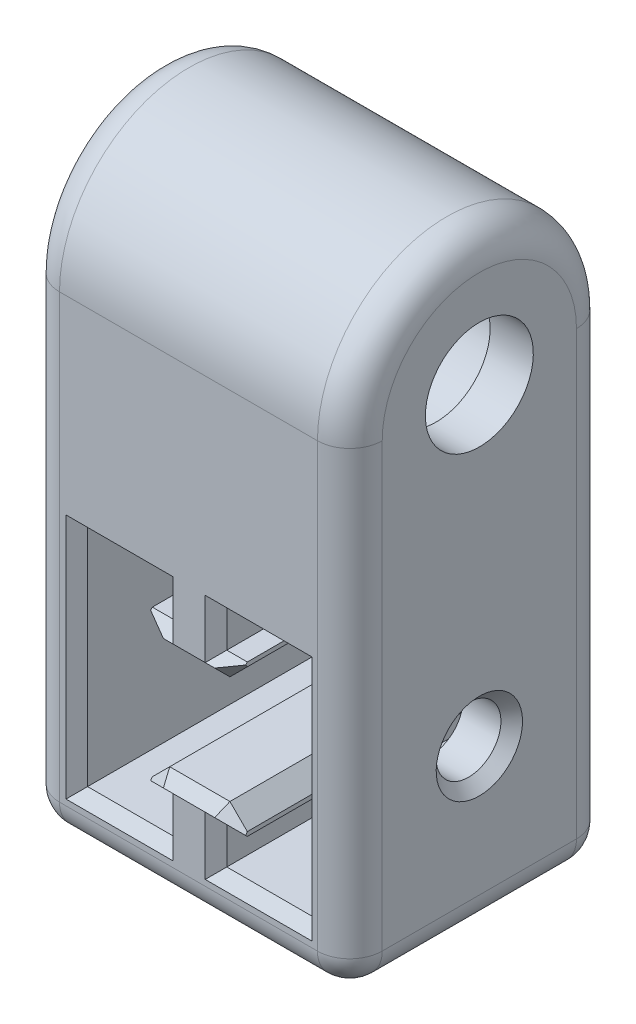
from build123d import *

# Parameters (mm, degrees)
BOSS_EXTRUDE1_DEPTH = 24
SKETCH5_R           = 6.9
BOSS_EXTRUDE3_DEPTH = 29.899298
SKETCH3_R           = 3
CUT_EXTRUDE1_DEPTH  = 57.133484
BOSS_EXTRUDE4_START = -4
SKETCH6_R           = 12
SKETCH6_R_2         = 5
BOSS_EXTRUDE4_DEPTH = 4
FILLET1_R           = 3
CHAMFER1_SIZE       = 1


with BuildPart() as part:
    # Sketch1 → Boss-Extrude1 (new body)
    with BuildSketch(Plane.XY):
        Polygon((0, 15), (14.899298, 15), (14.899298, -14.949649), (-15, -14.949649), (-15, 15), align=None)
        Polygon((-10.4, 10.4), (-2.5, 10.4), (-2.5, 7), (-4.4, 7), (-4.4, 6.61), (-2.79, 5), (2.79, 5), (4.4, 6.61), (4.4, 7), (2.5, 7), (2.5, 10.4), (10.4, 10.4), (10.4, 2.5), (10.4, -2.5), (10.4, -10.4), (2.5, -10.4), (2.5, -7), (4.4, -7), (4.4, -6.61), (2.79, -5), (-2.79, -5), (-4.4, -6.61), (-4.4, -7), (-2.5, -7), (-2.5, -10.4), (-10.4, -10.4), (-10.4, -2.5), (-10.4, 2.5), align=None, mode=Mode.SUBTRACT)
    extrude(amount=BOSS_EXTRUDE1_DEPTH)

    # Sketch5 → Boss-Extrude3 (add, through all)
    with BuildSketch(Plane.ZY.offset(15)):
        with BuildLine():
            Line((0, 15), (0, 22.5))
            Line((0, 22.5), (0, 29))
            ThreePointArc((0, 29), (12, 41), (24, 29))
            Line((24, 29), (24, 22.5))
            Line((24, 22.5), (24, 15))
            Line((24, 15), (0, 15))
        make_face()
        with Locations((12, 29)):
            Circle(SKETCH5_R, mode=Mode.SUBTRACT)
    extrude(amount=-BOSS_EXTRUDE3_DEPTH)

    # Sketch3 → Cut-Extrude1 (cut, through all)
    with BuildSketch(Plane.ZY.offset(15)):
        with Locations((12, 0)):
            Circle(SKETCH3_R)
    extrude(amount=-CUT_EXTRUDE1_DEPTH, mode=Mode.SUBTRACT)

    # Sketch6 → Boss-Extrude4 (add)
    with BuildSketch(Plane(origin=(14.899298, 0, 0), x_dir=(0, 0, -1), z_dir=(1, 0, 0)).offset(BOSS_EXTRUDE4_START)):
        with Locations((-12, 29)):
            Circle(SKETCH6_R)
        with Locations(Location((-12, 29, 0), (0, 0, 90))):
            Circle(SKETCH6_R_2, mode=Mode.SUBTRACT)
    extrude(amount=BOSS_EXTRUDE4_DEPTH)

    # Fillet1
    fillet1_edges = [part.edges().sort_by_distance(p)[0] for p in [
        (-0.050351, -14.949649, 24),
        (14.899298, 7.025175, 24),
        (14.899298, 0.025175, 0),
        (-0.050351, -14.949649, 0),
        (-15, 7.025175, 0),
        (-15, 7.025175, 24),
        (14.899298, -14.949649, 12),
        (-15, -14.949649, 12),
        (14.899298, 41, 12),
        (-15, 41, 12),
    ]]
    fillet(fillet1_edges, radius=FILLET1_R)

    # Chamfer1
    # the kernel refuses this chamfer: 1 mm, written as the material it takes off along each edge
    with BuildSketch(Plane(origin=(-15, 0, 12), x_dir=(0, 0, 1), z_dir=(0, -1, 0))) as chamfer1_piece_1:
        Polygon((3 + CHAMFER1_SIZE, 0), (3, -CHAMFER1_SIZE), (3, 0), align=None)
    revolve(axis=Axis((-15, 0, 12), (-1, 0, 0)), mode=Mode.SUBTRACT)
    with BuildSketch(Plane(origin=(-15, 29, 12), x_dir=(0, 0, 1), z_dir=(0, -1, 0))) as chamfer1_piece_2:
        Polygon((6.9, -CHAMFER1_SIZE), (6.9 + CHAMFER1_SIZE, 0), (6.9, 0), align=None)
    revolve(axis=Axis((-15, 29, 12), (-1, 0, 0)), mode=Mode.SUBTRACT)
    with BuildSketch(Plane(origin=(14.899298, 0, 12), x_dir=(0, 0, 1), z_dir=(0, -1, 0))) as chamfer1_piece_3:
        Polygon((3 + CHAMFER1_SIZE, 0), (3, CHAMFER1_SIZE), (3, 0), align=None)
    revolve(axis=Axis((14.899298, 0, 12), (-1, 0, 0)), mode=Mode.SUBTRACT)
    with BuildSketch(Plane(origin=(-2.5, 10.4, 24), x_dir=(0.9996219169112968, 1.9976458825347405e-14, 0.02749587661058563), z_dir=(0, -1, 0)), Plane(origin=(-2.5, -7, 24), x_dir=(0.9996219169112968, -3.394692349405443e-15, 0.02749587661058563), z_dir=(0, -1, 0)), Plane(origin=(2.5, -10.4, 24), x_dir=(-0.9996219169112968, -3.394692349405443e-15, 0.02749587661058563), z_dir=(0, 1, 0)), Plane(origin=(2.5, 7, 24), x_dir=(-0.9996219169112968, 4.700343253022921e-15, 0.02749587661058563), z_dir=(0, 1, 0))) as chamfer1_piece_4:
        Polygon((CHAMFER1_SIZE * 0.999621916911, -CHAMFER1_SIZE * 0.0274958766106), (-CHAMFER1_SIZE * 0.0274958766106, -CHAMFER1_SIZE * 0.999621916911), (0, 0), align=None)
    extrude(amount=3.4, mode=Mode.SUBTRACT)
    with BuildSketch(Plane(origin=(-10.4, 10.4, 24), x_dir=(0, 0.9996219169112968, 0.027495876610585647), z_dir=(1, 0, 0)), Plane(origin=(-2.5, -10.4, 24), x_dir=(0, -0.9996219169112968, 0.027495876610585647), z_dir=(-1, 0, 0)), Plane(origin=(10.4, -10.4, 24), x_dir=(2.247702821417434e-15, -0.9996219169112968, 0.027495876610585647), z_dir=(-1, 0, 0)), Plane(origin=(2.5, 10.4, 24), x_dir=(1.7981622571339484e-15, 0.9996219169112968, 0.027495876610585647), z_dir=(1, 0, 0)), Plane(origin=(-10.4, 10.4, 0), x_dir=(0, -0.02749587661058563, 0.9996219169112968), z_dir=(1, 0, 0))) as chamfer1_piece_5:
        Polygon((CHAMFER1_SIZE * 0.999621916911, -CHAMFER1_SIZE * 0.0274958766106), (-CHAMFER1_SIZE * 0.0274958766106, -CHAMFER1_SIZE * 0.999621916911), (0, 0), align=None)
    extrude(amount=7.9, mode=Mode.SUBTRACT)
    with BuildSketch(Plane(origin=(-10.4, 10.4, 24), x_dir=(-0.9996219169112968, 0, 0.027495876610585647), z_dir=(0, -1, 0)), Plane(origin=(10.4, -10.4, 24), x_dir=(0.9996219169112968, 0, 0.027495876610585647), z_dir=(0, 1, 0)), Plane(origin=(10.4, 10.4, 0), x_dir=(0.9996219169112968, 0, -0.027495876610586296), z_dir=(0, -1, 0)), Plane(origin=(-10.4, -10.4, 0), x_dir=(-0.9996219169112968, 0, -0.02749587661058661), z_dir=(0, 1, 0))) as chamfer1_piece_6:
        Polygon((CHAMFER1_SIZE * 0.999621916911, CHAMFER1_SIZE * 0.0274958766106), (-CHAMFER1_SIZE * 0.0274958766106, CHAMFER1_SIZE * 0.999621916911), (0, 0), align=None)
    extrude(amount=20.8, mode=Mode.SUBTRACT)
    with BuildSketch(Plane(origin=(-6.971683, -7, 24), x_dir=(0, 0.9996219169112968, 0.027495876610585623), z_dir=(1, 0, 0)), Plane(origin=(2.5, -7, 24), x_dir=(0, 0.9996219169112968, 0.027495876610585623), z_dir=(1, 0, 0)), Plane(origin=(6.971683, 7, 24), x_dir=(0, -0.9996219169112968, 0.027495876610585623), z_dir=(-1, 0, 0)), Plane(origin=(-2.5, 7, 24), x_dir=(0, -0.9996219169112968, 0.027495876610585623), z_dir=(-1, 0, 0))) as chamfer1_piece_7:
        Polygon((CHAMFER1_SIZE * 0.999621916911, -CHAMFER1_SIZE * 0.0274958766106), (-CHAMFER1_SIZE * 0.0274958766106, -CHAMFER1_SIZE * 0.999621916911), (0, 0), align=None)
    extrude(amount=4.471683, mode=Mode.SUBTRACT)
    with BuildSketch(Plane(origin=(-0.971546, -3.181546, 24), x_dir=(0.7068394360706722, -0.7068394360706748, 0.02749587661058563), z_dir=(-0.7071067811865488, -0.7071067811865462, 0)), Plane(origin=(6.218454, -8.428454, 24), x_dir=(-0.7068394360706722, -0.7068394360706749, 0.027495876610585664), z_dir=(-0.7071067811865488, 0.7071067811865462, 0)), Plane(origin=(0.971546, 3.181546, 24), x_dir=(-0.7068394360706717, 0.7068394360706753, 0.02749587661058563), z_dir=(0.7071067811865493, 0.7071067811865458, 0)), Plane(origin=(-6.218454, 8.428454, 24), x_dir=(0.7068394360706717, 0.7068394360706753, 0.02749587661058563), z_dir=(0.7071067811865493, -0.7071067811865458, 0))) as chamfer1_piece_8:
        Polygon((CHAMFER1_SIZE * 0.999621916911, -CHAMFER1_SIZE * 0.0274958766106), (-CHAMFER1_SIZE * 0.0274958766106, -CHAMFER1_SIZE * 0.999621916911), (0, 0), align=None)
    extrude(amount=7.42025, mode=Mode.SUBTRACT)
    with BuildSketch(Plane(origin=(5.361683, -5, 24), x_dir=(0, -0.9996219169112968, 0.027495876610585623), z_dir=(-1, 0, 0)), Plane(origin=(-5.361683, 5, 24), x_dir=(0, 0.9996219169112968, 0.027495876610585623), z_dir=(1, 0, 0))) as chamfer1_piece_9:
        Polygon((CHAMFER1_SIZE * 0.999621916911, -CHAMFER1_SIZE * 0.0274958766106), (-CHAMFER1_SIZE * 0.0274958766106, -CHAMFER1_SIZE * 0.999621916911), (0, 0), align=None)
    extrude(amount=10.723366, mode=Mode.SUBTRACT)
    with BuildSketch(Plane(origin=(-6.218454, 8.428454, 0), x_dir=(0.7068394360706717, 0.7068394360706753, -0.02749587661058635), z_dir=(0.7071067811865493, -0.7071067811865458, 0)), Plane(origin=(0.971546, 3.181546, 0), x_dir=(-0.7068394360706717, 0.7068394360706753, -0.027495876610586372), z_dir=(0.7071067811865493, 0.7071067811865458, 0)), Plane(origin=(6.218454, -8.428454, 0), x_dir=(-0.7068394360706722, -0.7068394360706749, -0.02749587661058643), z_dir=(-0.7071067811865488, 0.7071067811865462, 0)), Plane(origin=(-0.971546, -3.181546, 0), x_dir=(0.7068394360706722, -0.7068394360706749, -0.02749587661058638), z_dir=(-0.7071067811865488, -0.7071067811865462, 0))) as chamfer1_piece_10:
        Polygon((CHAMFER1_SIZE * 0.999621916911, CHAMFER1_SIZE * 0.0274958766106), (-CHAMFER1_SIZE * 0.0274958766106, CHAMFER1_SIZE * 0.999621916911), (0, 0), align=None)
    extrude(amount=7.42025, mode=Mode.SUBTRACT)
    with BuildSketch(Plane(origin=(-5.361683, 5, 0), x_dir=(0, 0.9996219169112968, -0.027495876610586365), z_dir=(1, 0, 0)), Plane(origin=(5.361683, -5, 0), x_dir=(0, -0.9996219169112968, -0.027495876610586365), z_dir=(-1, 0, 0))) as chamfer1_piece_11:
        Polygon((CHAMFER1_SIZE * 0.999621916911, CHAMFER1_SIZE * 0.0274958766106), (-CHAMFER1_SIZE * 0.0274958766106, CHAMFER1_SIZE * 0.999621916911), (0, 0), align=None)
    extrude(amount=10.723366, mode=Mode.SUBTRACT)
    with BuildSketch(Plane(origin=(6.971683, 7, 0), x_dir=(0, -0.9996219169112968, -0.027495876610586365), z_dir=(-1, 0, 0)), Plane(origin=(2.5, -7, 0), x_dir=(0, 0.9996219169112968, -0.027495876610586365), z_dir=(1, 0, 0)), Plane(origin=(-6.971683, -7, 0), x_dir=(0, 0.9996219169112968, -0.027495876610586365), z_dir=(1, 0, 0)), Plane(origin=(-2.5, 7, 0), x_dir=(0, -0.9996219169112968, -0.027495876610586365), z_dir=(-1, 0, 0))) as chamfer1_piece_12:
        Polygon((CHAMFER1_SIZE * 0.999621916911, CHAMFER1_SIZE * 0.0274958766106), (-CHAMFER1_SIZE * 0.0274958766106, CHAMFER1_SIZE * 0.999621916911), (0, 0), align=None)
    extrude(amount=4.471683, mode=Mode.SUBTRACT)
    with BuildSketch(Plane(origin=(2.5, 7, 0), x_dir=(-0.9996219169112968, 4.700343253022921e-15, -0.027495876610586372), z_dir=(0, 1, 0)), Plane(origin=(2.5, -10.4, 0), x_dir=(-0.9996219169112968, -3.394692349405443e-15, -0.027495876610586372), z_dir=(0, 1, 0)), Plane(origin=(-2.5, -7, 0), x_dir=(0.9996219169112968, -3.394692349405443e-15, -0.027495876610586372), z_dir=(0, -1, 0)), Plane(origin=(-2.5, 10.4, 0), x_dir=(0.9996219169112968, 1.9976458825347405e-14, -0.027495876610586372), z_dir=(0, -1, 0))) as chamfer1_piece_13:
        Polygon((CHAMFER1_SIZE * 0.999621916911, CHAMFER1_SIZE * 0.0274958766106), (-CHAMFER1_SIZE * 0.0274958766106, CHAMFER1_SIZE * 0.999621916911), (0, 0), align=None)
    extrude(amount=3.4, mode=Mode.SUBTRACT)
    with BuildSketch(Plane(origin=(2.5, 10.4, 0), x_dir=(1.7981622571339484e-15, 0.9996219169112968, -0.02749587661058639), z_dir=(1, 0, 0)), Plane(origin=(10.4, -10.4, 0), x_dir=(2.247702821417434e-15, -0.9996219169112968, -0.02749587661058639), z_dir=(-1, 0, 0)), Plane(origin=(-2.5, -10.4, 0), x_dir=(0, -0.9996219169112968, -0.02749587661058639), z_dir=(-1, 0, 0))) as chamfer1_piece_14:
        Polygon((CHAMFER1_SIZE * 0.999621916911, CHAMFER1_SIZE * 0.0274958766106), (-CHAMFER1_SIZE * 0.0274958766106, CHAMFER1_SIZE * 0.999621916911), (0, 0), align=None)
    extrude(amount=7.9, mode=Mode.SUBTRACT)
    with BuildSketch(Plane(origin=(-2.5, 12.971683, 24), x_dir=(0.9996219169112968, 1.9976458825347405e-14, 0.02749587661058563), z_dir=(0, -1, 0))) as chamfer1_piece_15a_section:
        Polygon((CHAMFER1_SIZE * 0.999621916911, -CHAMFER1_SIZE * 0.0274958766106), (-CHAMFER1_SIZE * 0.0274958766106, -CHAMFER1_SIZE * 0.999621916911), (0, 0), align=None)
    chamfer1_piece_15a = extrude(amount=5.971683, mode=Mode.PRIVATE)
    chamfer1_piece_15a = split(chamfer1_piece_15a, bisect_by=Plane(origin=(-2.170206, 10.4, 23.670206), z_dir=(0, 1, 0)), keep=Keep.TOP, mode=Mode.PRIVATE)
    with BuildSketch(Plane(origin=(-10.4, 10.4, 24), x_dir=(0, 0.9996219169112968, 0.027495876610585647), z_dir=(1, 0, 0))) as chamfer1_piece_15b_section:
        Polygon((CHAMFER1_SIZE * 0.999621916911, -CHAMFER1_SIZE * 0.0274958766106), (-CHAMFER1_SIZE * 0.0274958766106, -CHAMFER1_SIZE * 0.999621916911), (0, 0), align=None)
    chamfer1_piece_15b = extrude(amount=10.471683, mode=Mode.PRIVATE)
    chamfer1_piece_15b = split(chamfer1_piece_15b, bisect_by=Plane(origin=(-2.5, 10.729794, 23.670206), z_dir=(1, 0, 0)), keep=Keep.TOP, mode=Mode.PRIVATE)
    chamfer1_piece_15 = chamfer1_piece_15a & chamfer1_piece_15b
    add(chamfer1_piece_15, mode=Mode.SUBTRACT)
    with BuildSketch(Plane(origin=(0.071683, 7, 24), x_dir=(0, -0.9996219169112968, 0.027495876610585623), z_dir=(-1, 0, 0))) as chamfer1_piece_16a_section:
        Polygon((CHAMFER1_SIZE * 0.999621916911, -CHAMFER1_SIZE * 0.0274958766106), (-CHAMFER1_SIZE * 0.0274958766106, -CHAMFER1_SIZE * 0.999621916911), (0, 0), align=None)
    chamfer1_piece_16a = extrude(amount=7.043366, mode=Mode.PRIVATE)
    chamfer1_piece_16a = split(chamfer1_piece_16a, bisect_by=Plane(origin=(-2.5, 6.670206, 23.670206), z_dir=(1, 0, 0)), keep=Keep.TOP, mode=Mode.PRIVATE)
    with BuildSketch(Plane(origin=(-2.5, 10.4, 24), x_dir=(0.9996219169112968, 1.9976458825347405e-14, 0.02749587661058563), z_dir=(0, -1, 0))) as chamfer1_piece_16b_section:
        Polygon((CHAMFER1_SIZE * 0.999621916911, -CHAMFER1_SIZE * 0.0274958766106), (-CHAMFER1_SIZE * 0.0274958766106, -CHAMFER1_SIZE * 0.999621916911), (0, 0), align=None)
    chamfer1_piece_16b = extrude(amount=5.971683, mode=Mode.PRIVATE)
    chamfer1_piece_16b = split(chamfer1_piece_16b, bisect_by=Plane(origin=(-2.170206, 7, 23.670206), z_dir=(0, -1, 0)), keep=Keep.TOP, mode=Mode.PRIVATE)
    chamfer1_piece_16 = chamfer1_piece_16a & chamfer1_piece_16b
    add(chamfer1_piece_16, mode=Mode.SUBTRACT)
    with BuildSketch(Plane(origin=(-10.4, 12.971683, 24), x_dir=(-0.9996219169112968, 0, 0.027495876610585647), z_dir=(0, -1, 0))) as chamfer1_piece_17a_section:
        Polygon((CHAMFER1_SIZE * 0.999621916911, CHAMFER1_SIZE * 0.0274958766106), (-CHAMFER1_SIZE * 0.0274958766106, CHAMFER1_SIZE * 0.999621916911), (0, 0), align=None)
    chamfer1_piece_17a = extrude(amount=23.371683, mode=Mode.PRIVATE)
    chamfer1_piece_17a = split(chamfer1_piece_17a, bisect_by=Plane(origin=(-10.729794, 10.4, 23.670206), z_dir=(0, 1, 0)), keep=Keep.TOP, mode=Mode.PRIVATE)
    with BuildSketch(Plane(origin=(-12.971683, 10.4, 24), x_dir=(0, 0.9996219169112968, 0.027495876610585647), z_dir=(1, 0, 0))) as chamfer1_piece_17b_section:
        Polygon((CHAMFER1_SIZE * 0.999621916911, -CHAMFER1_SIZE * 0.0274958766106), (-CHAMFER1_SIZE * 0.0274958766106, -CHAMFER1_SIZE * 0.999621916911), (0, 0), align=None)
    chamfer1_piece_17b = extrude(amount=10.471683, mode=Mode.PRIVATE)
    chamfer1_piece_17b = split(chamfer1_piece_17b, bisect_by=Plane(origin=(-10.4, 10.729794, 23.670206), z_dir=(-1, 0, 0)), keep=Keep.TOP, mode=Mode.PRIVATE)
    chamfer1_piece_17 = chamfer1_piece_17a & chamfer1_piece_17b
    add(chamfer1_piece_17, mode=Mode.SUBTRACT)
    with BuildSketch(Plane(origin=(-10.4, 10.4, 24), x_dir=(-0.9996219169112968, 0, 0.027495876610585647), z_dir=(0, -1, 0))) as chamfer1_piece_18a_section:
        Polygon((CHAMFER1_SIZE * 0.999621916911, CHAMFER1_SIZE * 0.0274958766106), (-CHAMFER1_SIZE * 0.0274958766106, CHAMFER1_SIZE * 0.999621916911), (0, 0), align=None)
    chamfer1_piece_18a = extrude(amount=23.371683, mode=Mode.PRIVATE)
    chamfer1_piece_18a = split(chamfer1_piece_18a, bisect_by=Plane(origin=(-10.729794, -10.4, 23.670206), z_dir=(0, -1, 0)), keep=Keep.TOP, mode=Mode.PRIVATE)
    with BuildSketch(Plane(origin=(-2.5, -10.4, 24), x_dir=(0, -0.9996219169112968, 0.027495876610585647), z_dir=(-1, 0, 0))) as chamfer1_piece_18b_section:
        Polygon((CHAMFER1_SIZE * 0.999621916911, -CHAMFER1_SIZE * 0.0274958766106), (-CHAMFER1_SIZE * 0.0274958766106, -CHAMFER1_SIZE * 0.999621916911), (0, 0), align=None)
    chamfer1_piece_18b = extrude(amount=10.471683, mode=Mode.PRIVATE)
    chamfer1_piece_18b = split(chamfer1_piece_18b, bisect_by=Plane(origin=(-10.4, -10.729794, 23.670206), z_dir=(-1, 0, 0)), keep=Keep.TOP, mode=Mode.PRIVATE)
    chamfer1_piece_18 = chamfer1_piece_18a & chamfer1_piece_18b
    add(chamfer1_piece_18, mode=Mode.SUBTRACT)
    with BuildSketch(Plane(origin=(0.071683, -10.4, 24), x_dir=(0, -0.9996219169112968, 0.027495876610585647), z_dir=(-1, 0, 0))) as chamfer1_piece_19a_section:
        Polygon((CHAMFER1_SIZE * 0.999621916911, -CHAMFER1_SIZE * 0.0274958766106), (-CHAMFER1_SIZE * 0.0274958766106, -CHAMFER1_SIZE * 0.999621916911), (0, 0), align=None)
    chamfer1_piece_19a = extrude(amount=10.471683, mode=Mode.PRIVATE)
    chamfer1_piece_19a = split(chamfer1_piece_19a, bisect_by=Plane(origin=(-2.5, -10.729794, 23.670206), z_dir=(1, 0, 0)), keep=Keep.TOP, mode=Mode.PRIVATE)
    with BuildSketch(Plane(origin=(-2.5, -7, 24), x_dir=(0.9996219169112968, -3.394692349405443e-15, 0.02749587661058563), z_dir=(0, -1, 0))) as chamfer1_piece_19b_section:
        Polygon((CHAMFER1_SIZE * 0.999621916911, -CHAMFER1_SIZE * 0.0274958766106), (-CHAMFER1_SIZE * 0.0274958766106, -CHAMFER1_SIZE * 0.999621916911), (0, 0), align=None)
    chamfer1_piece_19b = extrude(amount=5.971683, mode=Mode.PRIVATE)
    chamfer1_piece_19b = split(chamfer1_piece_19b, bisect_by=Plane(origin=(-2.170206, -10.4, 23.670206), z_dir=(0, -1, 0)), keep=Keep.TOP, mode=Mode.PRIVATE)
    chamfer1_piece_19 = chamfer1_piece_19a & chamfer1_piece_19b
    add(chamfer1_piece_19, mode=Mode.SUBTRACT)
    with BuildSketch(Plane(origin=(-2.5, -4.428317, 24), x_dir=(0.9996219169112968, -3.394692349405443e-15, 0.02749587661058563), z_dir=(0, -1, 0))) as chamfer1_piece_20a_section:
        Polygon((CHAMFER1_SIZE * 0.999621916911, -CHAMFER1_SIZE * 0.0274958766106), (-CHAMFER1_SIZE * 0.0274958766106, -CHAMFER1_SIZE * 0.999621916911), (0, 0), align=None)
    chamfer1_piece_20a = extrude(amount=5.971683, mode=Mode.PRIVATE)
    chamfer1_piece_20a = split(chamfer1_piece_20a, bisect_by=Plane(origin=(-2.170206, -7, 23.670206), z_dir=(0, 1, 0)), keep=Keep.TOP, mode=Mode.PRIVATE)
    with BuildSketch(Plane(origin=(-6.971683, -7, 24), x_dir=(0, 0.9996219169112968, 0.027495876610585623), z_dir=(1, 0, 0))) as chamfer1_piece_20b_section:
        Polygon((CHAMFER1_SIZE * 0.999621916911, -CHAMFER1_SIZE * 0.0274958766106), (-CHAMFER1_SIZE * 0.0274958766106, -CHAMFER1_SIZE * 0.999621916911), (0, 0), align=None)
    chamfer1_piece_20b = extrude(amount=7.043366, mode=Mode.PRIVATE)
    chamfer1_piece_20b = split(chamfer1_piece_20b, bisect_by=Plane(origin=(-2.5, -6.670206, 23.670206), z_dir=(1, 0, 0)), keep=Keep.TOP, mode=Mode.PRIVATE)
    chamfer1_piece_20 = chamfer1_piece_20a & chamfer1_piece_20b
    add(chamfer1_piece_20, mode=Mode.SUBTRACT)
    with BuildSketch(Plane(origin=(-0.071683, -7, 24), x_dir=(0, 0.9996219169112968, 0.027495876610585623), z_dir=(1, 0, 0))) as chamfer1_piece_21a_section:
        Polygon((CHAMFER1_SIZE * 0.999621916911, -CHAMFER1_SIZE * 0.0274958766106), (-CHAMFER1_SIZE * 0.0274958766106, -CHAMFER1_SIZE * 0.999621916911), (0, 0), align=None)
    chamfer1_piece_21a = extrude(amount=7.043366, mode=Mode.PRIVATE)
    chamfer1_piece_21a = split(chamfer1_piece_21a, bisect_by=Plane(origin=(2.5, -6.670206, 23.670206), z_dir=(-1, 0, 0)), keep=Keep.TOP, mode=Mode.PRIVATE)
    with BuildSketch(Plane(origin=(2.5, -10.4, 24), x_dir=(-0.9996219169112968, -3.394692349405443e-15, 0.02749587661058563), z_dir=(0, 1, 0))) as chamfer1_piece_21b_section:
        Polygon((CHAMFER1_SIZE * 0.999621916911, -CHAMFER1_SIZE * 0.0274958766106), (-CHAMFER1_SIZE * 0.0274958766106, -CHAMFER1_SIZE * 0.999621916911), (0, 0), align=None)
    chamfer1_piece_21b = extrude(amount=5.971683, mode=Mode.PRIVATE)
    chamfer1_piece_21b = split(chamfer1_piece_21b, bisect_by=Plane(origin=(2.170206, -7, 23.670206), z_dir=(0, 1, 0)), keep=Keep.TOP, mode=Mode.PRIVATE)
    chamfer1_piece_21 = chamfer1_piece_21a & chamfer1_piece_21b
    add(chamfer1_piece_21, mode=Mode.SUBTRACT)
    with BuildSketch(Plane(origin=(2.5, -12.971683, 24), x_dir=(-0.9996219169112968, -3.394692349405443e-15, 0.02749587661058563), z_dir=(0, 1, 0))) as chamfer1_piece_22a_section:
        Polygon((CHAMFER1_SIZE * 0.999621916911, -CHAMFER1_SIZE * 0.0274958766106), (-CHAMFER1_SIZE * 0.0274958766106, -CHAMFER1_SIZE * 0.999621916911), (0, 0), align=None)
    chamfer1_piece_22a = extrude(amount=5.971683, mode=Mode.PRIVATE)
    chamfer1_piece_22a = split(chamfer1_piece_22a, bisect_by=Plane(origin=(2.170206, -10.4, 23.670206), z_dir=(0, -1, 0)), keep=Keep.TOP, mode=Mode.PRIVATE)
    with BuildSketch(Plane(origin=(10.4, -10.4, 24), x_dir=(2.247702821417434e-15, -0.9996219169112968, 0.027495876610585647), z_dir=(-1, 0, 0))) as chamfer1_piece_22b_section:
        Polygon((CHAMFER1_SIZE * 0.999621916911, -CHAMFER1_SIZE * 0.0274958766106), (-CHAMFER1_SIZE * 0.0274958766106, -CHAMFER1_SIZE * 0.999621916911), (0, 0), align=None)
    chamfer1_piece_22b = extrude(amount=10.471683, mode=Mode.PRIVATE)
    chamfer1_piece_22b = split(chamfer1_piece_22b, bisect_by=Plane(origin=(2.5, -10.729794, 23.670206), z_dir=(-1, 0, 0)), keep=Keep.TOP, mode=Mode.PRIVATE)
    chamfer1_piece_22 = chamfer1_piece_22a & chamfer1_piece_22b
    add(chamfer1_piece_22, mode=Mode.SUBTRACT)
    with BuildSketch(Plane(origin=(12.971683, -10.4, 24), x_dir=(2.247702821417434e-15, -0.9996219169112968, 0.027495876610585647), z_dir=(-1, 0, 0))) as chamfer1_piece_23a_section:
        Polygon((CHAMFER1_SIZE * 0.999621916911, -CHAMFER1_SIZE * 0.0274958766106), (-CHAMFER1_SIZE * 0.0274958766106, -CHAMFER1_SIZE * 0.999621916911), (0, 0), align=None)
    chamfer1_piece_23a = extrude(amount=10.471683, mode=Mode.PRIVATE)
    chamfer1_piece_23a = split(chamfer1_piece_23a, bisect_by=Plane(origin=(10.4, -10.729794, 23.670206), z_dir=(1, 0, 0)), keep=Keep.TOP, mode=Mode.PRIVATE)
    with BuildSketch(Plane(origin=(10.4, -12.971683, 24), x_dir=(0.9996219169112968, 0, 0.027495876610585647), z_dir=(0, 1, 0))) as chamfer1_piece_23b_section:
        Polygon((CHAMFER1_SIZE * 0.999621916911, CHAMFER1_SIZE * 0.0274958766106), (-CHAMFER1_SIZE * 0.0274958766106, CHAMFER1_SIZE * 0.999621916911), (0, 0), align=None)
    chamfer1_piece_23b = extrude(amount=23.371683, mode=Mode.PRIVATE)
    chamfer1_piece_23b = split(chamfer1_piece_23b, bisect_by=Plane(origin=(10.729794, -10.4, 23.670206), z_dir=(0, -1, 0)), keep=Keep.TOP, mode=Mode.PRIVATE)
    chamfer1_piece_23 = chamfer1_piece_23a & chamfer1_piece_23b
    add(chamfer1_piece_23, mode=Mode.SUBTRACT)
    with BuildSketch(Plane(origin=(10.4, -10.4, 24), x_dir=(0.9996219169112968, 0, 0.027495876610585647), z_dir=(0, 1, 0))) as chamfer1_piece_24a_section:
        Polygon((CHAMFER1_SIZE * 0.999621916911, CHAMFER1_SIZE * 0.0274958766106), (-CHAMFER1_SIZE * 0.0274958766106, CHAMFER1_SIZE * 0.999621916911), (0, 0), align=None)
    chamfer1_piece_24a = extrude(amount=23.371683, mode=Mode.PRIVATE)
    chamfer1_piece_24a = split(chamfer1_piece_24a, bisect_by=Plane(origin=(10.729794, 10.4, 23.670206), z_dir=(0, 1, 0)), keep=Keep.TOP, mode=Mode.PRIVATE)
    with BuildSketch(Plane(origin=(2.5, 10.4, 24), x_dir=(1.7981622571339484e-15, 0.9996219169112968, 0.027495876610585647), z_dir=(1, 0, 0))) as chamfer1_piece_24b_section:
        Polygon((CHAMFER1_SIZE * 0.999621916911, -CHAMFER1_SIZE * 0.0274958766106), (-CHAMFER1_SIZE * 0.0274958766106, -CHAMFER1_SIZE * 0.999621916911), (0, 0), align=None)
    chamfer1_piece_24b = extrude(amount=10.471683, mode=Mode.PRIVATE)
    chamfer1_piece_24b = split(chamfer1_piece_24b, bisect_by=Plane(origin=(10.4, 10.729794, 23.670206), z_dir=(1, 0, 0)), keep=Keep.TOP, mode=Mode.PRIVATE)
    chamfer1_piece_24 = chamfer1_piece_24a & chamfer1_piece_24b
    add(chamfer1_piece_24, mode=Mode.SUBTRACT)
    with BuildSketch(Plane(origin=(-0.071683, 10.4, 24), x_dir=(1.7981622571339484e-15, 0.9996219169112968, 0.027495876610585647), z_dir=(1, 0, 0))) as chamfer1_piece_25a_section:
        Polygon((CHAMFER1_SIZE * 0.999621916911, -CHAMFER1_SIZE * 0.0274958766106), (-CHAMFER1_SIZE * 0.0274958766106, -CHAMFER1_SIZE * 0.999621916911), (0, 0), align=None)
    chamfer1_piece_25a = extrude(amount=10.471683, mode=Mode.PRIVATE)
    chamfer1_piece_25a = split(chamfer1_piece_25a, bisect_by=Plane(origin=(2.5, 10.729794, 23.670206), z_dir=(-1, 0, 0)), keep=Keep.TOP, mode=Mode.PRIVATE)
    with BuildSketch(Plane(origin=(2.5, 7, 24), x_dir=(-0.9996219169112968, 4.700343253022921e-15, 0.02749587661058563), z_dir=(0, 1, 0))) as chamfer1_piece_25b_section:
        Polygon((CHAMFER1_SIZE * 0.999621916911, -CHAMFER1_SIZE * 0.0274958766106), (-CHAMFER1_SIZE * 0.0274958766106, -CHAMFER1_SIZE * 0.999621916911), (0, 0), align=None)
    chamfer1_piece_25b = extrude(amount=5.971683, mode=Mode.PRIVATE)
    chamfer1_piece_25b = split(chamfer1_piece_25b, bisect_by=Plane(origin=(2.170206, 10.4, 23.670206), z_dir=(0, 1, 0)), keep=Keep.TOP, mode=Mode.PRIVATE)
    chamfer1_piece_25 = chamfer1_piece_25a & chamfer1_piece_25b
    add(chamfer1_piece_25, mode=Mode.SUBTRACT)
    with BuildSketch(Plane(origin=(2.5, 4.428317, 24), x_dir=(-0.9996219169112968, 4.700343253022921e-15, 0.02749587661058563), z_dir=(0, 1, 0))) as chamfer1_piece_26a_section:
        Polygon((CHAMFER1_SIZE * 0.999621916911, -CHAMFER1_SIZE * 0.0274958766106), (-CHAMFER1_SIZE * 0.0274958766106, -CHAMFER1_SIZE * 0.999621916911), (0, 0), align=None)
    chamfer1_piece_26a = extrude(amount=5.971683, mode=Mode.PRIVATE)
    chamfer1_piece_26a = split(chamfer1_piece_26a, bisect_by=Plane(origin=(2.170206, 7, 23.670206), z_dir=(0, -1, 0)), keep=Keep.TOP, mode=Mode.PRIVATE)
    with BuildSketch(Plane(origin=(6.971683, 7, 24), x_dir=(0, -0.9996219169112968, 0.027495876610585623), z_dir=(-1, 0, 0))) as chamfer1_piece_26b_section:
        Polygon((CHAMFER1_SIZE * 0.999621916911, -CHAMFER1_SIZE * 0.0274958766106), (-CHAMFER1_SIZE * 0.0274958766106, -CHAMFER1_SIZE * 0.999621916911), (0, 0), align=None)
    chamfer1_piece_26b = extrude(amount=7.043366, mode=Mode.PRIVATE)
    chamfer1_piece_26b = split(chamfer1_piece_26b, bisect_by=Plane(origin=(2.5, 6.670206, 23.670206), z_dir=(-1, 0, 0)), keep=Keep.TOP, mode=Mode.PRIVATE)
    chamfer1_piece_26 = chamfer1_piece_26a & chamfer1_piece_26b
    add(chamfer1_piece_26, mode=Mode.SUBTRACT)
    with BuildSketch(Plane(origin=(2.5, 4.428317, 0), x_dir=(-0.9996219169112968, 4.700343253022921e-15, -0.027495876610586372), z_dir=(0, 1, 0))) as chamfer1_piece_27a_section:
        Polygon((CHAMFER1_SIZE * 0.999621916911, CHAMFER1_SIZE * 0.0274958766106), (-CHAMFER1_SIZE * 0.0274958766106, CHAMFER1_SIZE * 0.999621916911), (0, 0), align=None)
    chamfer1_piece_27a = extrude(amount=5.971683, mode=Mode.PRIVATE)
    chamfer1_piece_27a = split(chamfer1_piece_27a, bisect_by=Plane(origin=(2.170206, 7, 0.329794), z_dir=(0, -1, 0)), keep=Keep.TOP, mode=Mode.PRIVATE)
    with BuildSketch(Plane(origin=(6.971683, 7, 0), x_dir=(0, -0.9996219169112968, -0.027495876610586365), z_dir=(-1, 0, 0))) as chamfer1_piece_27b_section:
        Polygon((CHAMFER1_SIZE * 0.999621916911, CHAMFER1_SIZE * 0.0274958766106), (-CHAMFER1_SIZE * 0.0274958766106, CHAMFER1_SIZE * 0.999621916911), (0, 0), align=None)
    chamfer1_piece_27b = extrude(amount=7.043366, mode=Mode.PRIVATE)
    chamfer1_piece_27b = split(chamfer1_piece_27b, bisect_by=Plane(origin=(2.5, 6.670206, 0.329794), z_dir=(-1, 0, 0)), keep=Keep.TOP, mode=Mode.PRIVATE)
    chamfer1_piece_27 = chamfer1_piece_27a & chamfer1_piece_27b
    add(chamfer1_piece_27, mode=Mode.SUBTRACT)
    with BuildSketch(Plane(origin=(-0.071683, 10.4, 0), x_dir=(1.7981622571339484e-15, 0.9996219169112968, -0.02749587661058639), z_dir=(1, 0, 0))) as chamfer1_piece_28a_section:
        Polygon((CHAMFER1_SIZE * 0.999621916911, CHAMFER1_SIZE * 0.0274958766106), (-CHAMFER1_SIZE * 0.0274958766106, CHAMFER1_SIZE * 0.999621916911), (0, 0), align=None)
    chamfer1_piece_28a = extrude(amount=10.471683, mode=Mode.PRIVATE)
    chamfer1_piece_28a = split(chamfer1_piece_28a, bisect_by=Plane(origin=(2.5, 10.729794, 0.329794), z_dir=(-1, 0, 0)), keep=Keep.TOP, mode=Mode.PRIVATE)
    with BuildSketch(Plane(origin=(2.5, 7, 0), x_dir=(-0.9996219169112968, 4.700343253022921e-15, -0.027495876610586372), z_dir=(0, 1, 0))) as chamfer1_piece_28b_section:
        Polygon((CHAMFER1_SIZE * 0.999621916911, CHAMFER1_SIZE * 0.0274958766106), (-CHAMFER1_SIZE * 0.0274958766106, CHAMFER1_SIZE * 0.999621916911), (0, 0), align=None)
    chamfer1_piece_28b = extrude(amount=5.971683, mode=Mode.PRIVATE)
    chamfer1_piece_28b = split(chamfer1_piece_28b, bisect_by=Plane(origin=(2.170206, 10.4, 0.329794), z_dir=(0, 1, 0)), keep=Keep.TOP, mode=Mode.PRIVATE)
    chamfer1_piece_28 = chamfer1_piece_28a & chamfer1_piece_28b
    add(chamfer1_piece_28, mode=Mode.SUBTRACT)
    with BuildSketch(Plane(origin=(10.4, 12.971683, 0), x_dir=(0.9996219169112968, 0, -0.02749587661058639), z_dir=(0, -1, 0))) as chamfer1_piece_29a_section:
        Polygon((CHAMFER1_SIZE * 0.999621916911, CHAMFER1_SIZE * 0.0274958766106), (-CHAMFER1_SIZE * 0.0274958766106, CHAMFER1_SIZE * 0.999621916911), (0, 0), align=None)
    chamfer1_piece_29a = extrude(amount=23.371683, mode=Mode.PRIVATE)
    chamfer1_piece_29a = split(chamfer1_piece_29a, bisect_by=Plane(origin=(10.729794, 10.4, 0.329794), z_dir=(0, 1, 0)), keep=Keep.TOP, mode=Mode.PRIVATE)
    with BuildSketch(Plane(origin=(2.5, 10.4, 0), x_dir=(1.7981622571339484e-15, 0.9996219169112968, -0.02749587661058639), z_dir=(1, 0, 0))) as chamfer1_piece_29b_section:
        Polygon((CHAMFER1_SIZE * 0.999621916911, CHAMFER1_SIZE * 0.0274958766106), (-CHAMFER1_SIZE * 0.0274958766106, CHAMFER1_SIZE * 0.999621916911), (0, 0), align=None)
    chamfer1_piece_29b = extrude(amount=10.471683, mode=Mode.PRIVATE)
    chamfer1_piece_29b = split(chamfer1_piece_29b, bisect_by=Plane(origin=(10.4, 10.729794, 0.329794), z_dir=(1, 0, 0)), keep=Keep.TOP, mode=Mode.PRIVATE)
    chamfer1_piece_29 = chamfer1_piece_29a & chamfer1_piece_29b
    add(chamfer1_piece_29, mode=Mode.SUBTRACT)
    with BuildSketch(Plane(origin=(12.971683, -10.4, 0), x_dir=(2.247702821417434e-15, -0.9996219169112968, -0.02749587661058639), z_dir=(-1, 0, 0))) as chamfer1_piece_30a_section:
        Polygon((CHAMFER1_SIZE * 0.999621916911, CHAMFER1_SIZE * 0.0274958766106), (-CHAMFER1_SIZE * 0.0274958766106, CHAMFER1_SIZE * 0.999621916911), (0, 0), align=None)
    chamfer1_piece_30a = extrude(amount=10.471683, mode=Mode.PRIVATE)
    chamfer1_piece_30a = split(chamfer1_piece_30a, bisect_by=Plane(origin=(10.4, -10.729794, 0.329794), z_dir=(1, 0, 0)), keep=Keep.TOP, mode=Mode.PRIVATE)
    with BuildSketch(Plane(origin=(10.4, 10.4, 0), x_dir=(0.9996219169112968, 0, -0.027495876610586296), z_dir=(0, -1, 0))) as chamfer1_piece_30b_section:
        Polygon((CHAMFER1_SIZE * 0.999621916911, CHAMFER1_SIZE * 0.0274958766106), (-CHAMFER1_SIZE * 0.0274958766106, CHAMFER1_SIZE * 0.999621916911), (0, 0), align=None)
    chamfer1_piece_30b = extrude(amount=23.371683, mode=Mode.PRIVATE)
    chamfer1_piece_30b = split(chamfer1_piece_30b, bisect_by=Plane(origin=(10.729794, -10.4, 0.329794), z_dir=(0, -1, 0)), keep=Keep.TOP, mode=Mode.PRIVATE)
    chamfer1_piece_30 = chamfer1_piece_30a & chamfer1_piece_30b
    add(chamfer1_piece_30, mode=Mode.SUBTRACT)
    with BuildSketch(Plane(origin=(2.5, -12.971683, 0), x_dir=(-0.9996219169112968, -3.394692349405443e-15, -0.027495876610586372), z_dir=(0, 1, 0))) as chamfer1_piece_31a_section:
        Polygon((CHAMFER1_SIZE * 0.999621916911, CHAMFER1_SIZE * 0.0274958766106), (-CHAMFER1_SIZE * 0.0274958766106, CHAMFER1_SIZE * 0.999621916911), (0, 0), align=None)
    chamfer1_piece_31a = extrude(amount=5.971683, mode=Mode.PRIVATE)
    chamfer1_piece_31a = split(chamfer1_piece_31a, bisect_by=Plane(origin=(2.170206, -10.4, 0.329794), z_dir=(0, -1, 0)), keep=Keep.TOP, mode=Mode.PRIVATE)
    with BuildSketch(Plane(origin=(10.4, -10.4, 0), x_dir=(2.247702821417434e-15, -0.9996219169112968, -0.02749587661058639), z_dir=(-1, 0, 0))) as chamfer1_piece_31b_section:
        Polygon((CHAMFER1_SIZE * 0.999621916911, CHAMFER1_SIZE * 0.0274958766106), (-CHAMFER1_SIZE * 0.0274958766106, CHAMFER1_SIZE * 0.999621916911), (0, 0), align=None)
    chamfer1_piece_31b = extrude(amount=10.471683, mode=Mode.PRIVATE)
    chamfer1_piece_31b = split(chamfer1_piece_31b, bisect_by=Plane(origin=(2.5, -10.729794, 0.329794), z_dir=(-1, 0, 0)), keep=Keep.TOP, mode=Mode.PRIVATE)
    chamfer1_piece_31 = chamfer1_piece_31a & chamfer1_piece_31b
    add(chamfer1_piece_31, mode=Mode.SUBTRACT)
    with BuildSketch(Plane(origin=(-0.071683, -7, 0), x_dir=(0, 0.9996219169112968, -0.027495876610586365), z_dir=(1, 0, 0))) as chamfer1_piece_32a_section:
        Polygon((CHAMFER1_SIZE * 0.999621916911, CHAMFER1_SIZE * 0.0274958766106), (-CHAMFER1_SIZE * 0.0274958766106, CHAMFER1_SIZE * 0.999621916911), (0, 0), align=None)
    chamfer1_piece_32a = extrude(amount=7.043366, mode=Mode.PRIVATE)
    chamfer1_piece_32a = split(chamfer1_piece_32a, bisect_by=Plane(origin=(2.5, -6.670206, 0.329794), z_dir=(-1, 0, 0)), keep=Keep.TOP, mode=Mode.PRIVATE)
    with BuildSketch(Plane(origin=(2.5, -10.4, 0), x_dir=(-0.9996219169112968, -3.394692349405443e-15, -0.027495876610586372), z_dir=(0, 1, 0))) as chamfer1_piece_32b_section:
        Polygon((CHAMFER1_SIZE * 0.999621916911, CHAMFER1_SIZE * 0.0274958766106), (-CHAMFER1_SIZE * 0.0274958766106, CHAMFER1_SIZE * 0.999621916911), (0, 0), align=None)
    chamfer1_piece_32b = extrude(amount=5.971683, mode=Mode.PRIVATE)
    chamfer1_piece_32b = split(chamfer1_piece_32b, bisect_by=Plane(origin=(2.170206, -7, 0.329794), z_dir=(0, 1, 0)), keep=Keep.TOP, mode=Mode.PRIVATE)
    chamfer1_piece_32 = chamfer1_piece_32a & chamfer1_piece_32b
    add(chamfer1_piece_32, mode=Mode.SUBTRACT)
    with BuildSketch(Plane(origin=(-2.5, -4.428317, 0), x_dir=(0.9996219169112968, -3.394692349405443e-15, -0.027495876610586372), z_dir=(0, -1, 0))) as chamfer1_piece_33a_section:
        Polygon((CHAMFER1_SIZE * 0.999621916911, CHAMFER1_SIZE * 0.0274958766106), (-CHAMFER1_SIZE * 0.0274958766106, CHAMFER1_SIZE * 0.999621916911), (0, 0), align=None)
    chamfer1_piece_33a = extrude(amount=5.971683, mode=Mode.PRIVATE)
    chamfer1_piece_33a = split(chamfer1_piece_33a, bisect_by=Plane(origin=(-2.170206, -7, 0.329794), z_dir=(0, 1, 0)), keep=Keep.TOP, mode=Mode.PRIVATE)
    with BuildSketch(Plane(origin=(-6.971683, -7, 0), x_dir=(0, 0.9996219169112968, -0.027495876610586365), z_dir=(1, 0, 0))) as chamfer1_piece_33b_section:
        Polygon((CHAMFER1_SIZE * 0.999621916911, CHAMFER1_SIZE * 0.0274958766106), (-CHAMFER1_SIZE * 0.0274958766106, CHAMFER1_SIZE * 0.999621916911), (0, 0), align=None)
    chamfer1_piece_33b = extrude(amount=7.043366, mode=Mode.PRIVATE)
    chamfer1_piece_33b = split(chamfer1_piece_33b, bisect_by=Plane(origin=(-2.5, -6.670206, 0.329794), z_dir=(1, 0, 0)), keep=Keep.TOP, mode=Mode.PRIVATE)
    chamfer1_piece_33 = chamfer1_piece_33a & chamfer1_piece_33b
    add(chamfer1_piece_33, mode=Mode.SUBTRACT)
    with BuildSketch(Plane(origin=(0.071683, -10.4, 0), x_dir=(0, -0.9996219169112968, -0.02749587661058639), z_dir=(-1, 0, 0))) as chamfer1_piece_34a_section:
        Polygon((CHAMFER1_SIZE * 0.999621916911, CHAMFER1_SIZE * 0.0274958766106), (-CHAMFER1_SIZE * 0.0274958766106, CHAMFER1_SIZE * 0.999621916911), (0, 0), align=None)
    chamfer1_piece_34a = extrude(amount=10.471683, mode=Mode.PRIVATE)
    chamfer1_piece_34a = split(chamfer1_piece_34a, bisect_by=Plane(origin=(-2.5, -10.729794, 0.329794), z_dir=(1, 0, 0)), keep=Keep.TOP, mode=Mode.PRIVATE)
    with BuildSketch(Plane(origin=(-2.5, -7, 0), x_dir=(0.9996219169112968, -3.394692349405443e-15, -0.027495876610586372), z_dir=(0, -1, 0))) as chamfer1_piece_34b_section:
        Polygon((CHAMFER1_SIZE * 0.999621916911, CHAMFER1_SIZE * 0.0274958766106), (-CHAMFER1_SIZE * 0.0274958766106, CHAMFER1_SIZE * 0.999621916911), (0, 0), align=None)
    chamfer1_piece_34b = extrude(amount=5.971683, mode=Mode.PRIVATE)
    chamfer1_piece_34b = split(chamfer1_piece_34b, bisect_by=Plane(origin=(-2.170206, -10.4, 0.329794), z_dir=(0, -1, 0)), keep=Keep.TOP, mode=Mode.PRIVATE)
    chamfer1_piece_34 = chamfer1_piece_34a & chamfer1_piece_34b
    add(chamfer1_piece_34, mode=Mode.SUBTRACT)
    with BuildSketch(Plane(origin=(-10.4, -12.971683, 0), x_dir=(-0.9996219169112968, 0, -0.02749587661058639), z_dir=(0, 1, 0))) as chamfer1_piece_35a_section:
        Polygon((CHAMFER1_SIZE * 0.999621916911, CHAMFER1_SIZE * 0.0274958766106), (-CHAMFER1_SIZE * 0.0274958766106, CHAMFER1_SIZE * 0.999621916911), (0, 0), align=None)
    chamfer1_piece_35a = extrude(amount=23.371683, mode=Mode.PRIVATE)
    chamfer1_piece_35a = split(chamfer1_piece_35a, bisect_by=Plane(origin=(-10.729794, -10.4, 0.329794), z_dir=(0, -1, 0)), keep=Keep.TOP, mode=Mode.PRIVATE)
    with BuildSketch(Plane(origin=(-2.5, -10.4, 0), x_dir=(0, -0.9996219169112968, -0.02749587661058639), z_dir=(-1, 0, 0))) as chamfer1_piece_35b_section:
        Polygon((CHAMFER1_SIZE * 0.999621916911, CHAMFER1_SIZE * 0.0274958766106), (-CHAMFER1_SIZE * 0.0274958766106, CHAMFER1_SIZE * 0.999621916911), (0, 0), align=None)
    chamfer1_piece_35b = extrude(amount=10.471683, mode=Mode.PRIVATE)
    chamfer1_piece_35b = split(chamfer1_piece_35b, bisect_by=Plane(origin=(-10.4, -10.729794, 0.329794), z_dir=(-1, 0, 0)), keep=Keep.TOP, mode=Mode.PRIVATE)
    chamfer1_piece_35 = chamfer1_piece_35a & chamfer1_piece_35b
    add(chamfer1_piece_35, mode=Mode.SUBTRACT)
    with BuildSketch(Plane(origin=(-12.971683, 10.4, 0), x_dir=(0, -0.02749587661058563, 0.9996219169112968), z_dir=(1, 0, 0))) as chamfer1_piece_36a_section:
        Polygon((CHAMFER1_SIZE * 0.999621916911, -CHAMFER1_SIZE * 0.0274958766106), (-CHAMFER1_SIZE * 0.0274958766106, -CHAMFER1_SIZE * 0.999621916911), (0, 0), align=None)
    chamfer1_piece_36a = extrude(amount=10.471683, mode=Mode.PRIVATE)
    chamfer1_piece_36a = split(chamfer1_piece_36a, bisect_by=Plane(origin=(-10.4, 10.729794, 0.329794), z_dir=(-1, 0, 0)), keep=Keep.TOP, mode=Mode.PRIVATE)
    with BuildSketch(Plane(origin=(-10.4, -10.4, 0), x_dir=(-0.9996219169112968, 0, -0.02749587661058661), z_dir=(0, 1, 0))) as chamfer1_piece_36b_section:
        Polygon((CHAMFER1_SIZE * 0.999621916911, CHAMFER1_SIZE * 0.0274958766106), (-CHAMFER1_SIZE * 0.0274958766106, CHAMFER1_SIZE * 0.999621916911), (0, 0), align=None)
    chamfer1_piece_36b = extrude(amount=23.371683, mode=Mode.PRIVATE)
    chamfer1_piece_36b = split(chamfer1_piece_36b, bisect_by=Plane(origin=(-10.729794, 10.4, 0.329794), z_dir=(0, 1, 0)), keep=Keep.TOP, mode=Mode.PRIVATE)
    chamfer1_piece_36 = chamfer1_piece_36a & chamfer1_piece_36b
    add(chamfer1_piece_36, mode=Mode.SUBTRACT)
    with BuildSketch(Plane(origin=(-10.4, 10.4, 0), x_dir=(0, -0.02749587661058563, 0.9996219169112968), z_dir=(1, 0, 0))) as chamfer1_piece_37a_section:
        Polygon((CHAMFER1_SIZE * 0.999621916911, -CHAMFER1_SIZE * 0.0274958766106), (-CHAMFER1_SIZE * 0.0274958766106, -CHAMFER1_SIZE * 0.999621916911), (0, 0), align=None)
    chamfer1_piece_37a = extrude(amount=10.471683, mode=Mode.PRIVATE)
    chamfer1_piece_37a = split(chamfer1_piece_37a, bisect_by=Plane(origin=(-2.5, 10.729794, 0.329794), z_dir=(1, 0, 0)), keep=Keep.TOP, mode=Mode.PRIVATE)
    with BuildSketch(Plane(origin=(-2.5, 12.971683, 0), x_dir=(0.9996219169112968, 1.9976458825347405e-14, -0.027495876610586372), z_dir=(0, -1, 0))) as chamfer1_piece_37b_section:
        Polygon((CHAMFER1_SIZE * 0.999621916911, CHAMFER1_SIZE * 0.0274958766106), (-CHAMFER1_SIZE * 0.0274958766106, CHAMFER1_SIZE * 0.999621916911), (0, 0), align=None)
    chamfer1_piece_37b = extrude(amount=5.971683, mode=Mode.PRIVATE)
    chamfer1_piece_37b = split(chamfer1_piece_37b, bisect_by=Plane(origin=(-2.170206, 10.4, 0.329794), z_dir=(0, 1, 0)), keep=Keep.TOP, mode=Mode.PRIVATE)
    chamfer1_piece_37 = chamfer1_piece_37a & chamfer1_piece_37b
    add(chamfer1_piece_37, mode=Mode.SUBTRACT)
    with BuildSketch(Plane(origin=(0.071683, 7, 0), x_dir=(0, -0.9996219169112968, -0.027495876610586365), z_dir=(-1, 0, 0))) as chamfer1_piece_38a_section:
        Polygon((CHAMFER1_SIZE * 0.999621916911, CHAMFER1_SIZE * 0.0274958766106), (-CHAMFER1_SIZE * 0.0274958766106, CHAMFER1_SIZE * 0.999621916911), (0, 0), align=None)
    chamfer1_piece_38a = extrude(amount=7.043366, mode=Mode.PRIVATE)
    chamfer1_piece_38a = split(chamfer1_piece_38a, bisect_by=Plane(origin=(-2.5, 6.670206, 0.329794), z_dir=(1, 0, 0)), keep=Keep.TOP, mode=Mode.PRIVATE)
    with BuildSketch(Plane(origin=(-2.5, 10.4, 0), x_dir=(0.9996219169112968, 1.9976458825347405e-14, -0.027495876610586372), z_dir=(0, -1, 0))) as chamfer1_piece_38b_section:
        Polygon((CHAMFER1_SIZE * 0.999621916911, CHAMFER1_SIZE * 0.0274958766106), (-CHAMFER1_SIZE * 0.0274958766106, CHAMFER1_SIZE * 0.999621916911), (0, 0), align=None)
    chamfer1_piece_38b = extrude(amount=5.971683, mode=Mode.PRIVATE)
    chamfer1_piece_38b = split(chamfer1_piece_38b, bisect_by=Plane(origin=(-2.170206, 7, 0.329794), z_dir=(0, -1, 0)), keep=Keep.TOP, mode=Mode.PRIVATE)
    chamfer1_piece_38 = chamfer1_piece_38a & chamfer1_piece_38b
    add(chamfer1_piece_38, mode=Mode.SUBTRACT)


solid = part.part
